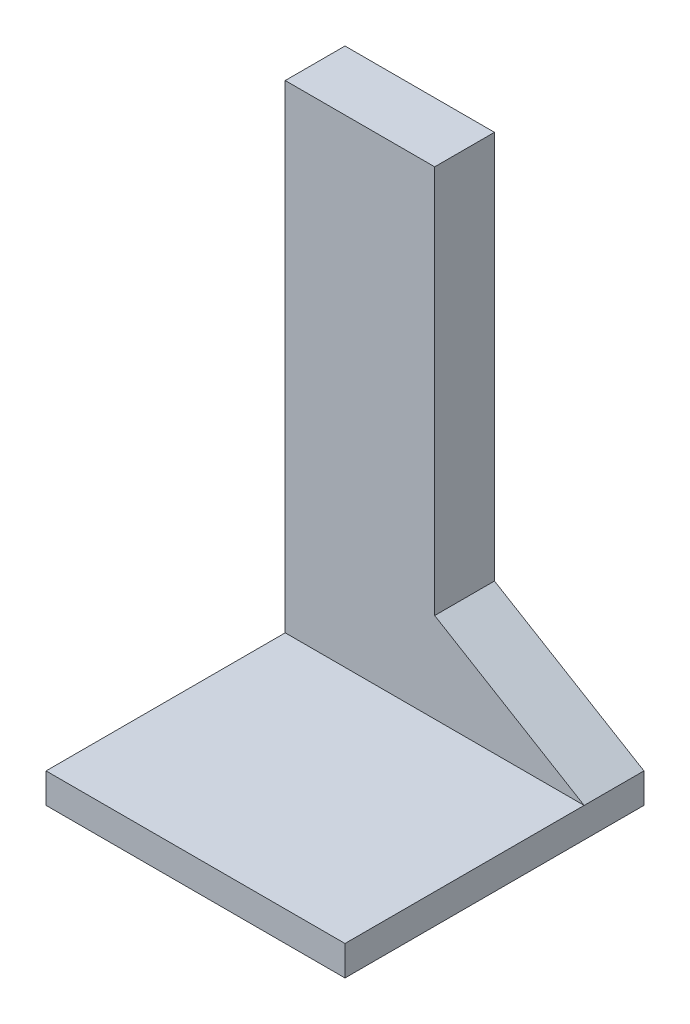
from build123d import *

# Parameters (mm, degrees)
SKETCH1_W           = 50
SKETCH1_H           = 50
BOSS_EXTRUDE1_DEPTH = 5
BOSS_EXTRUDE2_DEPTH = 10


with BuildPart() as part:
    # Sketch1 → Boss-Extrude1 (new body)
    with BuildSketch(Plane(origin=(0, 0, 0), x_dir=(1, 0, 0), z_dir=(0, 1, 0))):
        with Locations((-25, -25)):
            Rectangle(SKETCH1_W, SKETCH1_H)
    extrude(amount=BOSS_EXTRUDE1_DEPTH)

    # Sketch2 → Boss-Extrude2 (add)
    with BuildSketch(Plane.XY):
        Polygon((0, 5), (-25, 20), (-25, 85), (-50, 85), (-50, 5), align=None)
    extrude(amount=BOSS_EXTRUDE2_DEPTH)


solid = part.part
